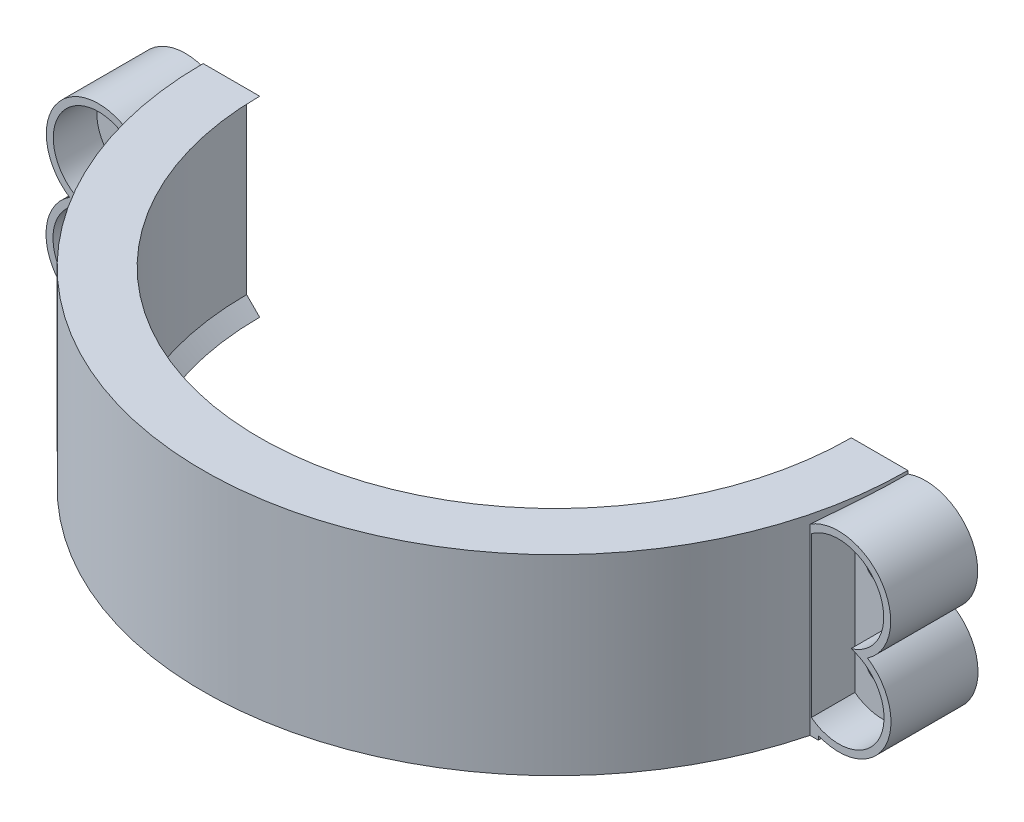
from build123d import *

# Parameters (mm, degrees)
REVOLVE1_ANGLE                  = 180
BOSS_EXTRUDE1_START             = -11
BOSS_EXTRUDE1_DEPTH             = 11
CUT_EXTRUDE1_REACH              = 68.374
BOSS_EXTRUDE2_REACH             = 67.327
BOSS_EXTRUDE2_END_RADIUS        = 40.5
SKETCH6_W                       = 25.4
SKETCH6_H                       = 18
BOSS_EXTRUDE2_DIRECTION_2_DEPTH = 15
SKETCH8_W                       = 4
SKETCH8_H                       = 19.884534
CUT_EXTRUDE3_DEPTH              = 80.722348
FILLET1_START                   = 2
FILLET1_DEPTH                   = 5
FILLET1_START_2                 = -11
FILLET1_2_DEPTH                 = 16.09884
FILLET1_START_3                 = 37
FILLET1_3_DEPTH                 = 28
FILLET1_START_4                 = 62
FILLET1_4_OUTLINE_W             = 4
FILLET1_4_OUTLINE_H             = 5
FILLET1_4_DEPTH                 = 3
FILLET1_START_5                 = 39.17071
FILLET1_5_OUTLINE_W             = 4
FILLET1_5_OUTLINE_H             = 5
FILLET1_5_DEPTH                 = 2.944756
FILLET1_6_DEPTH                 = 6
SKETCH9_R                       = 2
BOSS_EXTRUDE3_DEPTH             = 10
CUT_EXTRUDE4_DEPTH              = 75.187772
CUT_EXTRUDE4_DEPTH_BACK         = 5
CUT_EXTRUDE5_DEPTH              = 85.064413


with BuildPart() as part:
    # Sketch2 → Revolve1 (revolve, symmetric)
    with BuildSketch(Plane(origin=(0, 0, 0), x_dir=(0, 0, -1), z_dir=(1, 0, 0))) as revolve1_sk:
        Polygon((-34, -11), (-35.5, -9.5), (-35.5, 9.5), (-34, 11), (-35.5, 11), (-40.5, 11), (-40.5, -11), (-35.5, -11), align=None)
    revolve(axis=Axis((0, 0, 0), (0, 1, 0)), revolution_arc=REVOLVE1_ANGLE / 2)
    revolve(revolve1_sk.sketch, axis=Axis((0, 0, 0), (0, -1, 0)), revolution_arc=REVOLVE1_ANGLE / 2)

    # Sketch3 → Boss-Extrude1 (add)
    with BuildSketch(Plane(origin=(0, 0, 0), x_dir=(1, 0, 0), z_dir=(0, 1, 0)).offset(BOSS_EXTRUDE1_START)):
        with BuildLine():
            ThreePointArc((-40.5, 0), (0, -40.5), (40.5, 0))
            add(Edge.make_bspline(
                [(40.5, 0), (41.574904, -20.679763), (31.861074, -51.110818), (0, -51.360442)],
                knots=[0, 0, 0, 0, 1, 1, 1, 1], degree=3))
            add(Edge.make_bspline(
                [(-40.5, 0), (-41.574904, -20.679763), (-31.861074, -51.110818), (0, -51.360442)],
                knots=[0, 0, 0, 0, 1, 1, 1, 1], degree=3))
        make_face()
    extrude(amount=BOSS_EXTRUDE1_DEPTH)

    # Sketch5 → Cut-Extrude1 (cut, up to next)
    with BuildSketch(Plane(origin=(0, 0, 0), x_dir=(1, 0, 0), z_dir=(0, 1, 0)), mode=Mode.PRIVATE) as cut_extrude1_sk1:
        Polygon((32.298595, -50), (-32.298595, -50), (-4.520904, -70.798059), align=None)
    cut_extrude1_tool1 = extrude(cut_extrude1_sk1.sketch, amount=-CUT_EXTRUDE1_REACH, mode=Mode.PRIVATE) & part.part
    add(cut_extrude1_tool1.solids().sort_by_distance((-1.506968, 0, 56.932686))[0], mode=Mode.SUBTRACT)

    # Boss-Extrude2: up to this cylinder (the profile starts outside it)
    boss_extrude2_end = Plane(origin=(0, -2, 0), z_dir=(0, -1, 0)) * Cylinder(BOSS_EXTRUDE2_END_RADIUS, 216.654, mode=Mode.PRIVATE)
    # Sketch6 → Boss-Extrude2 (add, up to the surface)
    with BuildSketch(Plane.XY.offset(50), mode=Mode.PRIVATE) as boss_extrude2_sk1:
        with Locations((0, -2)):
            Rectangle(SKETCH6_W, SKETCH6_H)
    boss_extrude2_tool1 = extrude(boss_extrude2_sk1.sketch, amount=-BOSS_EXTRUDE2_REACH, mode=Mode.PRIVATE) - boss_extrude2_end
    add(boss_extrude2_tool1.solids().sort_by_distance((0, -2, 50))[0])

    # Sketch6 → Boss-Extrude2 direction 2 (add)
    with BuildSketch(Plane.XY.offset(50)):
        with Locations((0, -2)):
            Rectangle(SKETCH6_W, SKETCH6_H)
    extrude(amount=BOSS_EXTRUDE2_DIRECTION_2_DEPTH)

    # Sketch8 → Cut-Extrude3 (cut, through all)
    with BuildSketch(Plane(origin=(0, 11, 0), x_dir=(1, 0, 0), z_dir=(0, 1, 0))):
        with BuildLine():
            Line((15.113165, -40.129156), (15.113165, -45.006528))
            add(Edge.make_bspline(
                [(15.113165, -45.006528), (20.553217, -43.096096), (30.745136, -32.716473), (33.442003, -26.840069)],
                knots=[0, 0, 0, 0, 1, 1, 1, 1], degree=3))
            ThreePointArc((33.442003, -26.840069), (25.17044, -34.716075), (15.113165, -40.129156))
        make_face()
        with BuildLine():
            Line((-15.113165, -40.129156), (-15.113165, -45.006528))
            add(Edge.make_bspline(
                [(-15.113165, -45.006528), (-20.553217, -43.096096), (-30.745136, -32.716473), (-33.442003, -26.840069)],
                knots=[0, 0, 0, 0, 1, 1, 1, 1], degree=3))
            ThreePointArc((-33.442003, -26.840069), (-25.17044, -34.716075), (-15.113165, -40.129156))
        make_face()
        with Locations((0, -52.057733)):
            Rectangle(SKETCH8_W, SKETCH8_H)
    extrude(amount=-CUT_EXTRUDE3_DEPTH, mode=Mode.SUBTRACT)

    # Fillet1: read off the stored shape, not the designer's step
    # Fillet1 outline → Fillet1 (cut)
    with BuildSketch(Plane(origin=(0, 0, 0), x_dir=(1, 0, 0), z_dir=(0, 1, 0)).offset(FILLET1_START)):
        with BuildLine():
            Line((-12.7, -65), (12.7, -65))
            Line((12.7, -65), (12.7, -38.457249))
            ThreePointArc((12.7, -38.457249), (0, -40.5), (-12.7, -38.457249))
            Line((-12.7, -38.457249), (-12.7, -65))
        make_face()
    extrude(amount=FILLET1_DEPTH, mode=Mode.SUBTRACT)

    # Fillet1 2 outline → Fillet1 2 (cut)
    with BuildSketch(Plane(origin=(0, 0, 0), x_dir=(1, 0, 0), z_dir=(0, 1, 0)).offset(FILLET1_START_2)):
        with BuildLine():
            Line((-12.7, -65), (-7.7, -65))
            add(Edge.make_bspline(
                [(-7.7, -65), (-12.7, -65), (-12.7, -60)],
                knots=[0, 0, 0, 1, 1, 1], degree=2, weights=[1, 0.707107, 1]))
            Line((-12.7, -60), (-12.7, -65))
        make_face()
        with BuildLine():
            add(Edge.make_bspline(
                [(7.7, -65), (12.7, -65), (12.7, -60)],
                knots=[0, 0, 0, 1, 1, 1], degree=2, weights=[1, 0.707107, 1]))
            Line((7.7, -65), (12.7, -65))
            Line((12.7, -65), (12.7, -60))
        make_face()
    extrude(amount=FILLET1_2_DEPTH, mode=Mode.SUBTRACT)

    # Fillet1 3 outline → Fillet1 3 (add)
    with BuildSketch(Plane.XY.offset(FILLET1_START_3)):
        with BuildLine():
            add(Edge.make_bspline(
                [(-12.7, 2), (-12.7, 7), (-7.7, 7)],
                knots=[0, 0, 0, 1, 1, 1], degree=2, weights=[1, 0.707107, 1]))
            Line((-12.7, 2), (-2, 2))
            Line((-2, 2), (-2, 7))
            Line((-2, 7), (-7.7, 7))
        make_face()
        with BuildLine():
            Line((2, 7), (2, 2))
            Line((2, 2), (12.7, 2))
            add(Edge.make_bspline(
                [(7.7, 7), (12.7, 7), (12.7, 2)],
                knots=[0, 0, 0, 1, 1, 1], degree=2, weights=[1, 0.707107, 1]))
            Line((7.7, 7), (2, 7))
        make_face()
    extrude(amount=FILLET1_3_DEPTH)

    # Fillet1 4 outline → Fillet1 4 (add)
    with BuildSketch(Plane.XY.offset(FILLET1_START_4)):
        with Locations((0, 4.5)):
            Rectangle(FILLET1_4_OUTLINE_W, FILLET1_4_OUTLINE_H)
    extrude(amount=FILLET1_4_DEPTH)

    # Fillet1 5 outline → Fillet1 5 (add)
    with BuildSketch(Plane.XY.offset(FILLET1_START_5)):
        with Locations((0, 4.5)):
            Rectangle(FILLET1_5_OUTLINE_W, FILLET1_5_OUTLINE_H)
    extrude(amount=FILLET1_5_DEPTH)

    # Fillet1 6 outline → Fillet1 6 (cut)
    with BuildSketch(Plane(origin=(0, 0, 0), x_dir=(1, 0, 0), z_dir=(0, 1, 0)).offset(FILLET1_START)):
        with BuildLine():
            Line((-12.7, -65), (-7.7, -65))
            add(Edge.make_bspline(
                [(-12.7, -60), (-12.7, -60.274102), (-12.679965, -60.548369), (-12.639842, -60.820553), (-12.536378, -61.284433), (-12.482162, -61.478121), (-12.41762, -61.668662), (-12.288664, -61.991396), (-12.22893, -62.125441), (-12.163988, -62.25706), (-11.922281, -62.702191), (-11.720174, -63.002028), (-11.490067, -63.281001), (-10.981001, -63.790067), (-10.702028, -64.020174), (-10.402191, -64.222281), (-9.95706, -64.463988), (-9.825441, -64.52893), (-9.691396, -64.588664), (-9.368662, -64.71762), (-9.178121, -64.782162), (-8.984433, -64.836378), (-8.520553, -64.939842), (-8.248369, -64.979965), (-7.974102, -65), (-7.7, -65)],
                knots=[0, 0, 0, 0, 0, 0.139857, 0.139857, 0.139857, 0.242164, 0.242164, 0.242164, 0.316823, 0.316823, 0.316823, 0.5, 0.5, 0.5, 0.683177, 0.683177, 0.683177, 0.757836, 0.757836, 0.757836, 0.860143, 0.860143, 0.860143, 1, 1, 1, 1, 1], degree=4))
            Line((-12.7, -60), (-12.7, -65))
        make_face()
        with BuildLine():
            Line((12.7, -65), (12.7, -60))
            add(Edge.make_bspline(
                [(12.7, -60), (12.7, -60.274102), (12.679965, -60.548369), (12.639842, -60.820553), (12.536378, -61.284433), (12.482162, -61.478121), (12.41762, -61.668662), (12.288664, -61.991396), (12.22893, -62.125441), (12.163988, -62.25706), (11.922281, -62.702191), (11.720174, -63.002028), (11.490067, -63.281001), (10.981001, -63.790067), (10.702028, -64.020174), (10.402191, -64.222281), (9.95706, -64.463988), (9.825441, -64.52893), (9.691396, -64.588664), (9.368662, -64.71762), (9.178121, -64.782162), (8.984433, -64.836378), (8.520553, -64.939842), (8.248369, -64.979965), (7.974102, -65), (7.7, -65)],
                knots=[0, 0, 0, 0, 0, 0.139857, 0.139857, 0.139857, 0.242164, 0.242164, 0.242164, 0.316823, 0.316823, 0.316823, 0.5, 0.5, 0.5, 0.683177, 0.683177, 0.683177, 0.757836, 0.757836, 0.757836, 0.860143, 0.860143, 0.860143, 1, 1, 1, 1, 1], degree=4))
            Line((7.7, -65), (12.7, -65))
        make_face()
    extrude(amount=FILLET1_6_DEPTH, mode=Mode.SUBTRACT)

    # Sketch9 → Boss-Extrude3 (add)
    # profile 1 of 2: a face of its own
    with BuildSketch(Plane.XY):
        with BuildLine():
            ThreePointArc((39.222943, -0.011905), (42.578982, -10.999961), (45.856052, 0.011905))
            ThreePointArc((45.856052, 0.011905), (42.500013, 10.999961), (39.222943, -0.011905))
        make_face()
        with Locations((42.557445, -5)):
            Circle(SKETCH9_R, mode=Mode.SUBTRACT)
        with Locations((42.52155, 5)):
            Circle(SKETCH9_R, mode=Mode.SUBTRACT)
    # profile 2 of 2: a face of its own
    with BuildSketch(Plane.XY):
        with BuildLine():
            ThreePointArc((-39.222943, -0.011905), (-42.578982, -10.999961), (-45.856052, 0.011905))
            ThreePointArc((-45.856052, 0.011905), (-42.500013, 10.999961), (-39.222943, -0.011905))
        make_face()
        with Locations(Location((-42.557445, -5, 0), (0, 0, 180))):
            Circle(SKETCH9_R, mode=Mode.SUBTRACT)
        with Locations(Location((-42.52155, 5, 0), (0, 0, 180))):
            Circle(SKETCH9_R, mode=Mode.SUBTRACT)
    extrude(amount=BOSS_EXTRUDE3_DEPTH)

    # Sketch10 → Cut-Extrude4 (cut, two sides: drawn at the far end of the back side and taken through both)
    with BuildSketch(Plane.XY.offset(10).offset(-CUT_EXTRUDE4_DEPTH_BACK)):
        with BuildLine():
            Line((39.407769, -9.137577), (39.407769, 9.164657))
            ThreePointArc((39.407769, 9.164657), (47.176604, 7.317427), (43.967661, 0.005126))
            ThreePointArc((43.967661, 0.005126), (47.210797, -7.320844), (39.407769, -9.137577))
        make_face()
        with BuildLine():
            Line((-39.407769, -9.137577), (-39.407769, 9.164657))
            ThreePointArc((-39.407769, 9.164657), (-47.176604, 7.317427), (-43.967661, 0.005126))
            ThreePointArc((-43.967661, 0.005126), (-47.210797, -7.320844), (-39.407769, -9.137577))
        make_face()
    extrude(amount=CUT_EXTRUDE4_DEPTH + CUT_EXTRUDE4_DEPTH_BACK, mode=Mode.SUBTRACT)

    # Sketch11 → Cut-Extrude5 (cut, through all)
    with BuildSketch(Plane(origin=(0, 11, 0), x_dir=(1, 0, 0), z_dir=(0, 1, 0))):
        with BuildLine():
            Line((48.52155, -10), (39.246019, -10))
            ThreePointArc((39.246019, -10), (0, -40.5), (-39.246019, -10))
            Line((-39.246019, -10), (-48.52155, -10))
            Line((-48.52155, -10), (-48.52155, -69.748878))
            Line((-48.52155, -69.748878), (48.52155, -69.748878))
            Line((48.52155, -69.748878), (48.52155, -10))
        make_face()
    extrude(amount=-CUT_EXTRUDE5_DEPTH, mode=Mode.SUBTRACT)


solid = part.part
